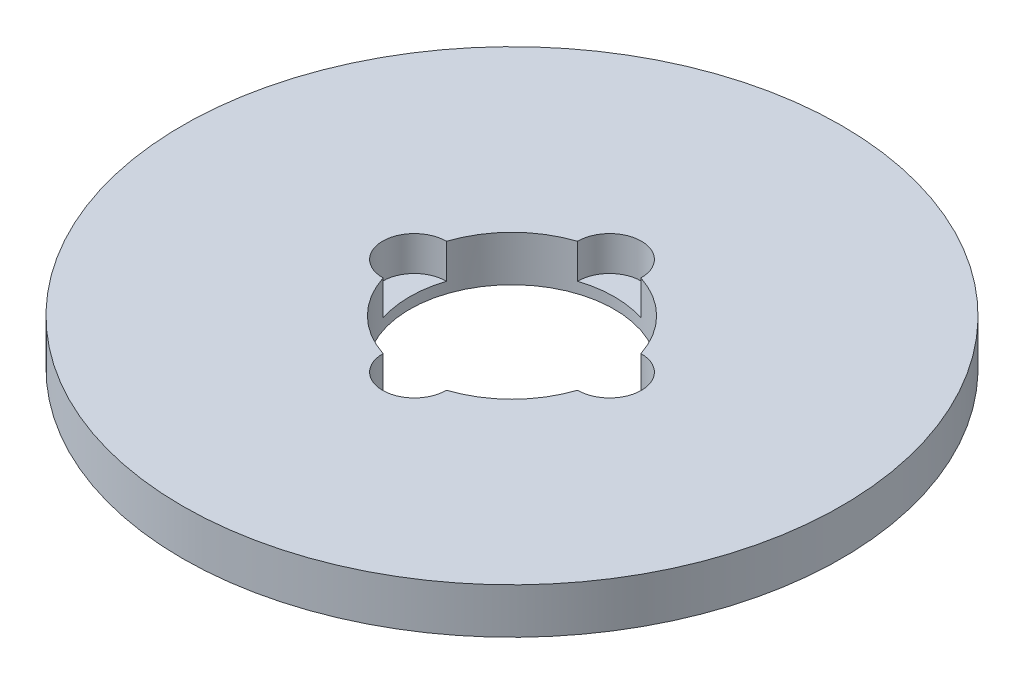
from build123d import *

# Parameters (mm, degrees)
SKETCH1_R           = 72.5
BOSS_EXTRUDE1_DEPTH = 10
SKETCH2_R           = 22.5
CUT_EXTRUDE1_DEPTH  = 104.01698889
SKETCH3_R           = 6.970478639
CUT_EXTRUDE2_DEPTH  = 7.611654329
CIRPATTERN1_COUNT   = 4


with BuildPart() as part:
    # Sketch1 → Boss-Extrude1 (new body)
    with BuildSketch(Plane(origin=(0, 0, 0), x_dir=(1, 0, 0), z_dir=(0, 1, 0))):
        Circle(SKETCH1_R)
    extrude(amount=BOSS_EXTRUDE1_DEPTH)

    # Sketch2 → Cut-Extrude1 (cut, through all)
    with BuildSketch(Plane(origin=(0, 0, 0), x_dir=(1, 0, 0), z_dir=(0, 1, 0))):
        Circle(SKETCH2_R)
    extrude(amount=CUT_EXTRUDE1_DEPTH, mode=Mode.SUBTRACT)

    # Sketch3 → Cut-Extrude2 (cut)
    with BuildSketch(Plane(origin=(0, 10, 0), x_dir=(1, 0, 0), z_dir=(0, 1, 0))):
        with Locations((-21.475098113, 0)):
            Circle(SKETCH3_R)
    cut_extrude2 = extrude(amount=-CUT_EXTRUDE2_DEPTH, mode=Mode.SUBTRACT)

    # CirPattern1: Cut-Extrude2 ×4 about axis
    cirpattern1_axis = Axis((0, 0, 0), (0, 1, 0))
    for i in range(1, CIRPATTERN1_COUNT):
        add(cut_extrude2.rotate(cirpattern1_axis, i * 360 / CIRPATTERN1_COUNT), mode=Mode.SUBTRACT)


solid = part.part
